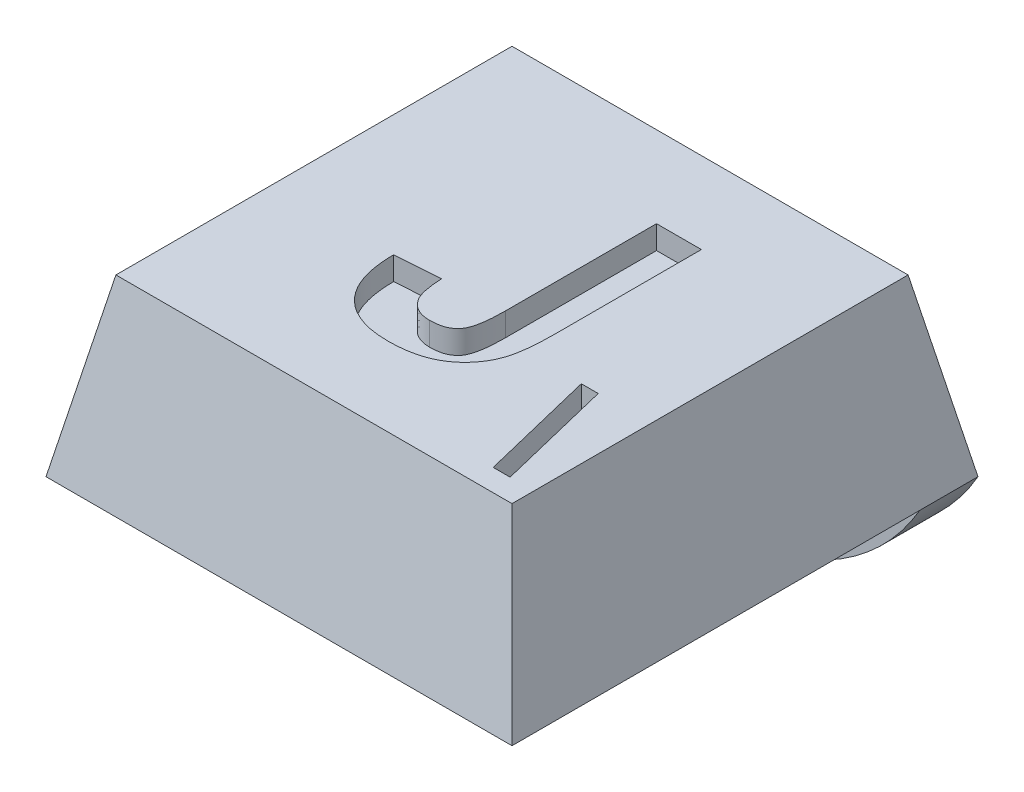
from build123d import *

# Parameters (mm, degrees)
SKETCH1_W               = 8
SKETCH1_H               = 8
BOSS_EXTRUDE1_DEPTH     = 3
CUT_EXTRUDE1_DEPTH      = 12.704699911
CUT_EXTRUDE1_DEPTH_BACK = 12.704699911
CUT_EXTRUDE2_DEPTH      = 11
SKETCH4_R               = 1.75
CUT_EXTRUDE3_DEPTH      = 0.4
SKETCH5_W               = 8
SKETCH5_H               = 1
BOSS_EXTRUDE2_DEPTH     = 2
FILLET1_R               = 4
CUT_EXTRUDE4_DEPTH      = 0.4
CUT_EXTRUDE5_DEPTH      = 0.5


with BuildPart() as part:
    # Sketch1 → Boss-Extrude1 (new body)
    with BuildSketch(Plane(origin=(0, 0, 0), x_dir=(1, 0, 0), z_dir=(0, 1, 0))):
        with Locations((4, 4)):
            Rectangle(SKETCH1_W, SKETCH1_H)
    extrude(amount=BOSS_EXTRUDE1_DEPTH)

    # Sketch2 → Cut-Extrude1 (cut, two sides: drawn at the far end of the back side and taken through both)
    with BuildSketch(Plane.XY.offset(-CUT_EXTRUDE1_DEPTH_BACK)):
        Polygon((0, 0), (0.6, 3), (0, 3), align=None)
        Polygon((8, 0), (7.4, 3), (8, 3), align=None)
    extrude(amount=CUT_EXTRUDE1_DEPTH + CUT_EXTRUDE1_DEPTH_BACK, mode=Mode.SUBTRACT)

    # Sketch3 → Cut-Extrude2 (cut)
    with BuildSketch(Plane(origin=(0, 0, 0), x_dir=(0, 0, -1), z_dir=(1, 0, 0))):
        Polygon((0, 0), (0.6, 3), (0, 3), align=None)
        Polygon((8, 3), (7.4, 3), (8, 0), align=None)
    extrude(amount=CUT_EXTRUDE2_DEPTH, mode=Mode.SUBTRACT)

    # Sketch4 → Cut-Extrude3 (cut)
    with BuildSketch(Plane.XZ):
        with Locations(Location((4, -3.75, 0), (0, 0, 270))):
            Circle(SKETCH4_R)
    extrude(amount=-CUT_EXTRUDE3_DEPTH, mode=Mode.SUBTRACT)

    # Sketch5 → Boss-Extrude2 (add)
    with BuildSketch(Plane.XZ):
        with Locations((4, -7.5)):
            Rectangle(SKETCH5_W, SKETCH5_H)
    extrude(amount=BOSS_EXTRUDE2_DEPTH)

    # Fillet1
    # the kernel refuses this fillet: 4 mm, written as the material it takes off along each edge
    with BuildSketch(Plane(origin=(8, -2, -16.660254038), x_dir=(0, 1, 0), z_dir=(0, 0, 1)), Plane(origin=(0, -2, 1.660254038), x_dir=(0, 1, 0), z_dir=(0, 0, -1))) as fillet1_piece_1:
        with BuildLine():
            CenterArc((4, 3.464101615), FILLET1_R, 180, 60)
            Line((0, 3.464101615), (-0.08, 3.464101615))
            Line((-0.08, 3.464101615), (-0.08, 0))
            Line((-0.08, 0), (0, -0.08))
            ThreePointArc((0, -0.08), (1, -0.08), (1.96, -0.069282032))
            Line((1.96, -0.069282032), (2, 0))
        make_face()
    extrude(amount=18.320508076, mode=Mode.SUBTRACT)

    # Sketch6 → Cut-Extrude4 (cut)
    with BuildSketch(Plane(origin=(0, 3, 0), x_dir=(1, 0, 0), z_dir=(0, 1, 0))):
        with BuildLine():
            Line((4.478635236, 6.002856352), (5.247866005, 6.002856352))
            Line((5.247866005, 6.002856352), (5.247866005, 3.481221736))
            add(Edge.make_bspline(
                [(5.247866005, 3.481221736), (5.247522255, 3.441153869), (5.246855206, 3.363401883), (5.242756502, 3.250390465), (5.236658321, 3.14454193), (5.227277222, 3.045871471), (5.21405872, 2.954592388), (5.200049867, 2.869976575), (5.183041427, 2.792451692), (5.167800036, 2.743951306), (5.160526262, 2.72080507)],
                knots=[0, 0, 0, 0, 1.251619961, 2.428777588, 3.532126049, 4.56323557, 5.523704531, 6.412540087, 7.242403515, 8, 8, 8, 8], degree=3))
            add(Edge.make_bspline(
                [(5.160526262, 2.72080507), (5.150361081, 2.692282601), (5.130243602, 2.635834988), (5.091141653, 2.555314881), (5.046176431, 2.479084315), (4.995474484, 2.406812938), (4.939514717, 2.338210987), (4.876399077, 2.275086649), (4.8083478, 2.215238098), (4.733446681, 2.161145289), (4.653580791, 2.110709794), (4.566475051, 2.068688963), (4.473843299, 2.032340387), (4.374908104, 2.002816628), (4.269640778, 1.979716073), (4.158311001, 1.962901894), (4.040770466, 1.95334773), (3.960490164, 1.952175274), (3.919340364, 1.9515743)],
                knots=[0, 0, 0, 0, 0.925533072, 1.831683394, 2.73255258, 3.630007683, 4.529542467, 5.436465751, 6.357118906, 7.298274949, 8.259461937, 9.242242071, 10.251058183, 11.300341426, 12.396409345, 13.544807631, 14.74152597, 16, 16, 16, 16], degree=3))
            add(Edge.make_bspline(
                [(3.919340364, 1.9515743), (3.871225528, 1.952737211), (3.777685944, 1.954998015), (3.641661475, 1.97000769), (3.514100564, 1.996260242), (3.395387048, 2.034179675), (3.284307874, 2.08131717), (3.182206561, 2.140114726), (3.088540477, 2.209392701), (3.003918711, 2.289363431), (2.928299433, 2.379218215), (2.863026475, 2.479745415), (2.80762712, 2.589893743), (2.762984692, 2.710161506), (2.727739397, 2.839972913), (2.702317462, 2.979601288), (2.687147894, 3.129126134), (2.684913172, 3.2319872), (2.683763441, 3.284907634)],
                knots=[0, 0, 0, 0, 1.114068574, 2.165849827, 3.164101702, 4.124467949, 5.046988974, 5.952942428, 6.846011651, 7.738523925, 8.642829306, 9.558838605, 10.50752403, 11.491963144, 12.524197802, 13.618364352, 14.774685164, 16, 16, 16, 16], degree=3))
            Line((2.683763441, 3.284907634), (3.45299421, 3.336189685))
            add(Edge.make_bspline(
                [(3.45299421, 3.336189685), (3.454375767, 3.307862598), (3.45702498, 3.25354382), (3.464380935, 3.175240866), (3.473682687, 3.103271277), (3.485853837, 3.037851064), (3.498960823, 2.978427444), (3.515987002, 2.926169857), (3.533886556, 2.879240769), (3.549608387, 2.851783511), (3.557160877, 2.838593531)],
                knots=[0, 0, 0, 0, 1.326609226, 2.543847584, 3.678365909, 4.719972403, 5.656527627, 6.521948534, 7.28997025, 8, 8, 8, 8], degree=3))
            add(Edge.make_bspline(
                [(3.557160877, 2.838593531), (3.56872297, 2.821148121), (3.59147861, 2.786813382), (3.632990929, 2.742071605), (3.677558537, 2.702955843), (3.727619554, 2.672203009), (3.781780527, 2.648016829), (3.840448037, 2.63044225), (3.903460331, 2.619785853), (3.946808463, 2.61876437), (3.969019851, 2.618240967)],
                knots=[0, 0, 0, 0, 1.023658308, 2.014687051, 2.979722519, 3.920049697, 4.880550909, 5.878122304, 6.912759386, 8, 8, 8, 8], degree=3))
            add(Edge.make_bspline(
                [(3.969019851, 2.618240967), (3.991477248, 2.618659453), (4.034647527, 2.619463917), (4.09686091, 2.626779219), (4.154063033, 2.638632824), (4.206285054, 2.655294856), (4.253703868, 2.676924623), (4.295268393, 2.704596166), (4.33276969, 2.735732915), (4.36516489, 2.773188264), (4.392766236, 2.818318957), (4.415812105, 2.873248962), (4.43563784, 2.938204221), (4.450960178, 3.01367855), (4.464002509, 3.098949399), (4.472183692, 3.194770716), (4.478064386, 3.300859295), (4.478439634, 3.37517575), (4.478635236, 3.413914044)],
                knots=[0, 0, 0, 0, 0.980314827, 1.884477813, 2.730827652, 3.527503874, 4.27366112, 4.998269146, 5.70163477, 6.396145331, 7.150281155, 8.001758491, 8.990432449, 10.111292654, 11.361572691, 12.75538406, 14.308707205, 16, 16, 16, 16], degree=3))
            Line((4.478635236, 3.413914044), (4.478635236, 6.002856352))
        make_face()
    extrude(amount=-CUT_EXTRUDE4_DEPTH, mode=Mode.SUBTRACT)

    # Sketch7 → Cut-Extrude5 (cut)
    with BuildSketch(Plane(origin=(0, 3, 0), x_dir=(1, 0, 0), z_dir=(0, 1, 0))):
        Polygon((6.21271865, 2.977310221), (6.502782752, 2.977310221), (6.989962239, 0.977310221), (6.700298778, 0.977310221), align=None)
    extrude(amount=-CUT_EXTRUDE5_DEPTH, mode=Mode.SUBTRACT)


solid = part.part
